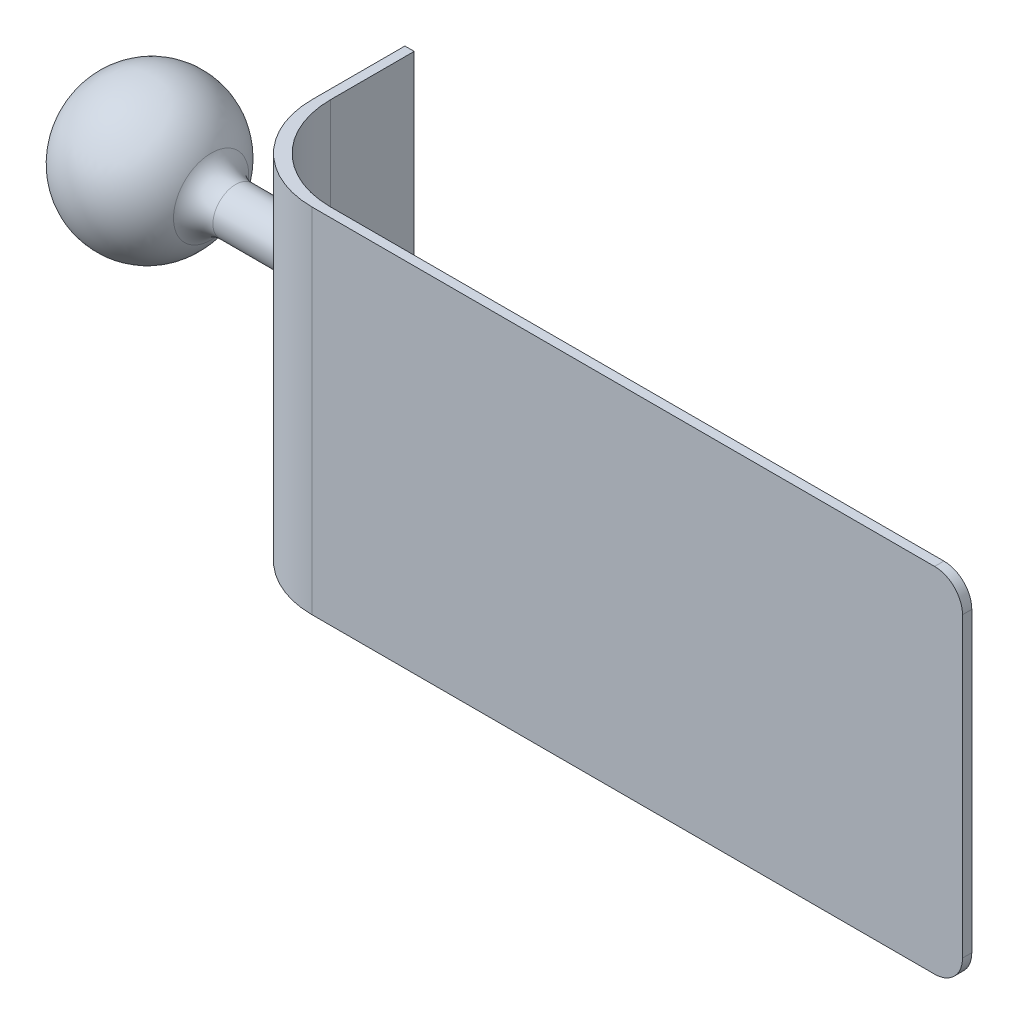
from build123d import *

# Parameters (mm, degrees)
BOSS_EXTRUDE1_DEPTH = 19
FILLET1_R           = 3
FILLET2_R           = 10
FILLET3_R           = 3


with BuildPart() as part:
    # Sketch1 → Boss-Extrude1 (new, symmetric)
    with BuildSketch(Plane(origin=(0, 0, 0), x_dir=(1, 0, 0), z_dir=(0, 1, 0))):
        Polygon((0, 0), (0, -19), (79, -19), (79, -20), (-1, -20), (-1, 0), align=None)
    extrude(amount=BOSS_EXTRUDE1_DEPTH, both=True)

    # Fillet1
    fillet1_edges = [part.edges().sort_by_distance(p)[0] for p in [
        (79, 19, 19.5),
        (79, -19, 19.5),
    ]]
    fillet(fillet1_edges, radius=FILLET1_R)

    # Fillet2
    fillet2_edges = [part.edges().sort_by_distance(p)[0] for p in [
        (0, 0, 19),
        (-1, 0, 20),
    ]]
    fillet(fillet2_edges, radius=FILLET2_R)

    # Sketch2 → Revolve2 (revolve)
    with BuildSketch(Plane(origin=(0, 0, 0), x_dir=(1, 0, 0), z_dir=(0, 1, 0))):
        with BuildLine():
            Line((-0.773743612, -3), (-15.773743612, -3))
            ThreePointArc((-15.773743612, -3), (-24.25464239, 2.469780889), (-30.503131217, -5.454897934))
            Line((-30.503131217, -5.454897934), (-0.503131217, -5.454897934))
            Line((-0.503131217, -5.454897934), (-0.773743612, -3))
        make_face()
    revolve(axis=Axis((-0.503131217, 0, 5.454897934), (-1, 0, 0)))

    # Fillet3
    fillet3_edges = [part.edges().sort_by_distance(p)[0] for p in [
        (-15.773743612, 0, 7.909795868),
        (-1, 0, 7.909795868),
    ]]
    fillet(fillet3_edges, radius=FILLET3_R - 0.0001)  # a hair under: the kernel refuses the full size


solid = part.part
